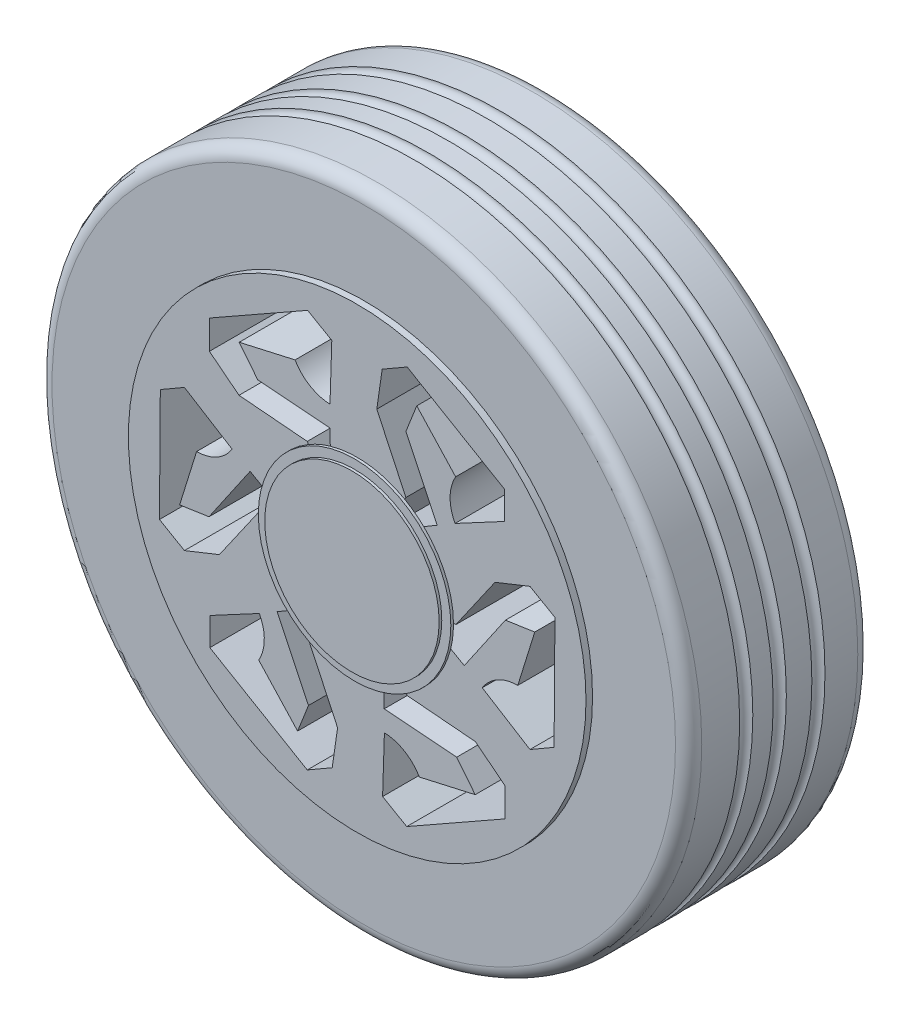
from build123d import *

# Parameters (mm, degrees)
SKETCH2_R            = 247.55
BOSS_EXTRUDE1_DEPTH  = 138.9
FILLET1_R            = 10
FILLET2_R            = 10
SKETCH3_R            = 174.35
BOSS_EXTRUDE2_DEPTH  = 5
CUT_EXTRUDE1_DEPTH   = 178
SKETCH9_R            = 73.351235991
BOSS_EXTRUDE3_DEPTH  = 2
SKETCH10_R           = 66.449367693
BOSS_EXTRUDE4_DEPTH  = 2
CUT_SWEEP1_PROFILE_R = 5
CUT_SWEEP2_PROFILE_R = 5
CUT_SWEEP3_PROFILE_R = 5


with BuildPart() as part:
    # Sketch2 → Boss-Extrude1 (new body)
    with BuildSketch(Plane.XY):
        Circle(SKETCH2_R)
    extrude(amount=BOSS_EXTRUDE1_DEPTH)

    # Fillet1
    fillet1_edges = [part.edges().sort_by_distance(p)[0] for p in [
        (-247.55, 0, 138.9),
    ]]
    fillet(fillet1_edges, radius=FILLET1_R)

    # Fillet2
    fillet2_edges = [part.edges().sort_by_distance(p)[0] for p in [
        (-247.55, 0, 0),
    ]]
    fillet(fillet2_edges, radius=FILLET2_R)

    # Sketch3 → Boss-Extrude2 (add)
    with BuildSketch(Plane.XY.offset(138.9)):
        Circle(SKETCH3_R)
    extrude(amount=BOSS_EXTRUDE2_DEPTH)

    # Sketch5 → Cut-Extrude1 (cut)
    with BuildSketch(Plane.XY.offset(143.9)):
        with BuildLine():
            Line((105.003706731, 43.369407929), (131.633696581, 54.021395774))
            Line((131.633696581, 54.021395774), (150.665269372, 43.031925067))
            Line((150.665269372, 43.031925067), (150.344554361, -0.360940867))
            Line((150.344554361, -0.360940867), (150.02910614, -43.041207894))
            Line((150.02910614, -43.041207894), (131.640430833, -53.657914533))
            Line((131.640430833, -53.657914533), (95.29019948, -31.084252667))
            ThreePointArc((95.29019948, -31.084252667), (106.873400183, -20.029907867), (122.363240346, -15.976029572))
            Line((122.363240346, -15.976029572), (135.299603851, 25.697677813))
            Line((135.299603851, 25.697677813), (112.925565246, 22.34468352))
            Line((112.925565246, 22.34468352), (81.592210025, -23.310129617))
            Line((81.592210025, -23.310129617), (40.25767623, 0.148769441))
            Line((40.25767623, 0.148769441), (75.177682959, 0.55093352))
            Line((75.177682959, 0.55093352), (105.003706731, 43.369407929))
        make_face()
        with BuildLine():
            Line((90.060862379, -69.251173556), (112.600749379, -86.987427346))
            Line((112.600749379, -86.987427346), (112.599374968, -108.963988211))
            Line((112.599374968, -108.963988211), (74.859693221, -130.38267383))
            Line((74.859693221, -130.38267383), (37.739773625, -151.449621172))
            Line((37.739773625, -151.449621172), (19.351098317, -140.832914533))
            Line((19.351098317, -140.832914533), (20.725347273, -98.065859815))
            ThreePointArc((20.725347273, -98.065859815), (36.090291044, -102.570033481), (47.345972712, -113.957689415))
            Line((47.345972712, -113.957689415), (89.90464373, -104.32405515))
            Line((89.90464373, -104.32405515), (75.813846191, -86.62406648))
            Line((75.813846191, -86.62406648), (20.608940598, -82.315991441))
            Line((20.608940598, -82.315991441), (20.25767623, -34.789785592))
            Line((20.25767623, -34.789785592), (38.065963903, -64.83031648))
            Line((38.065963903, -64.83031648), (90.060862379, -69.251173556))
        make_face()
        with BuildLine():
            Line((19.032947202, 141.008823121), (38.065894405, 151.995913278))
            Line((38.065894405, 151.995913278), (75.48486114, 130.021732964))
            Line((75.48486114, 130.021732964), (112.289332516, 108.408413278))
            Line((112.289332516, 108.408413278), (112.289332516, 87.175))
            Line((112.289332516, 87.175), (74.564852207, 66.981607148))
            ThreePointArc((74.564852207, 66.981607148), (70.78310914, 82.540125614), (75.017267633, 97.981659843))
            Line((75.017267633, 97.981659843), (45.394960121, 130.021732964))
            Line((45.394960121, 130.021732964), (37.111719056, 108.96875))
            Line((37.111719056, 108.96875), (60.983269426, 59.005861824))
            Line((60.983269426, 59.005861824), (20, 34.938555033))
            Line((20, 34.938555033), (37.111719056, 65.38125))
            Line((37.111719056, 65.38125), (14.942844352, 112.620581485))
            Line((14.942844352, 112.620581485), (19.032947202, 141.008823121))
        make_face()
        with BuildLine():
            Line((-14.942844352, -112.620581485), (-19.032947202, -141.008823121))
            Line((-19.032947202, -141.008823121), (-38.065894405, -151.995913278))
            Line((-38.065894405, -151.995913278), (-75.48486114, -130.021732964))
            Line((-75.48486114, -130.021732964), (-112.289332516, -108.408413278))
            Line((-112.289332516, -108.408413278), (-112.289332516, -87.175))
            Line((-112.289332516, -87.175), (-74.564852207, -66.981607148))
            ThreePointArc((-74.564852207, -66.981607148), (-70.78310914, -82.540125614), (-75.017267633, -97.981659843))
            Line((-75.017267633, -97.981659843), (-45.394960121, -130.021732964))
            Line((-45.394960121, -130.021732964), (-37.111719056, -108.96875))
            Line((-37.111719056, -108.96875), (-60.983269426, -59.005861824))
            Line((-60.983269426, -59.005861824), (-20, -34.938555033))
            Line((-20, -34.938555033), (-37.111719056, -65.38125))
            Line((-37.111719056, -65.38125), (-14.942844352, -112.620581485))
        make_face()
        with BuildLine():
            Line((-105.003706731, -43.369407929), (-131.633696581, -54.021395774))
            Line((-131.633696581, -54.021395774), (-150.665269372, -43.031925067))
            Line((-150.665269372, -43.031925067), (-150.344554361, 0.360940867))
            Line((-150.344554361, 0.360940867), (-150.02910614, 43.041207894))
            Line((-150.02910614, 43.041207894), (-131.640430833, 53.657914533))
            Line((-131.640430833, 53.657914533), (-95.29019948, 31.084252667))
            ThreePointArc((-95.29019948, 31.084252667), (-106.873400183, 20.029907867), (-122.363240346, 15.976029572))
            Line((-122.363240346, 15.976029572), (-135.299603851, -25.697677813))
            Line((-135.299603851, -25.697677813), (-112.925565246, -22.34468352))
            Line((-112.925565246, -22.34468352), (-81.592210025, 23.310129617))
            Line((-81.592210025, 23.310129617), (-40.25767623, -0.148769441))
            Line((-40.25767623, -0.148769441), (-75.177682959, -0.55093352))
            Line((-75.177682959, -0.55093352), (-105.003706731, -43.369407929))
        make_face()
        with BuildLine():
            Line((-90.060862379, 69.251173556), (-112.600749379, 86.987427346))
            Line((-112.600749379, 86.987427346), (-112.599374968, 108.963988211))
            Line((-112.599374968, 108.963988211), (-74.859693221, 130.38267383))
            Line((-74.859693221, 130.38267383), (-37.739773625, 151.449621172))
            Line((-37.739773625, 151.449621172), (-19.351098317, 140.832914533))
            Line((-19.351098317, 140.832914533), (-20.725347273, 98.065859815))
            ThreePointArc((-20.725347273, 98.065859815), (-36.090291044, 102.570033481), (-47.345972712, 113.957689415))
            Line((-47.345972712, 113.957689415), (-89.90464373, 104.32405515))
            Line((-89.90464373, 104.32405515), (-75.813846191, 86.62406648))
            Line((-75.813846191, 86.62406648), (-20.608940598, 82.315991441))
            Line((-20.608940598, 82.315991441), (-20.25767623, 34.789785592))
            Line((-20.25767623, 34.789785592), (-38.065963903, 64.83031648))
            Line((-38.065963903, 64.83031648), (-90.060862379, 69.251173556))
        make_face()
    extrude(amount=-CUT_EXTRUDE1_DEPTH, mode=Mode.SUBTRACT)

    # Sketch9 → Boss-Extrude3 (add)
    with BuildSketch(Plane.XY.offset(143.9)):
        Circle(SKETCH9_R)
    extrude(amount=BOSS_EXTRUDE3_DEPTH)

    # Sketch10 → Boss-Extrude4 (add)
    with BuildSketch(Plane.XY.offset(145.9)):
        Circle(SKETCH10_R)
    extrude(amount=BOSS_EXTRUDE4_DEPTH)

    # Cut-Sweep1: sweep along a path in Sketch16
    with BuildLine(Plane.XY.offset(40)) as cut_sweep1_path:
        CenterArc((0, 0), 247.55, 0, 360)
    # Cut-Sweep1 profile (on start of the path) → Cut-Sweep1 (sweep, cut)
    with BuildSketch(Plane(origin=(247.55, 0, 40), x_dir=(0, 0, 1), z_dir=(0, 1, 0))):
        Circle(CUT_SWEEP1_PROFILE_R)
    sweep(path=cut_sweep1_path.line, mode=Mode.SUBTRACT)

    # Cut-Sweep2: sweep along a path in Sketch15
    with BuildLine(Plane.XY.offset(69.45)) as cut_sweep2_path:
        CenterArc((0, 0), 247.55, 0, 360)
    # Cut-Sweep2 profile (on start of the path) → Cut-Sweep2 (sweep, cut)
    with BuildSketch(Plane(origin=(247.55, 0, 69.45), x_dir=(0, 0, 1), z_dir=(0, 1, 0))):
        Circle(CUT_SWEEP2_PROFILE_R)
    sweep(path=cut_sweep2_path.line, mode=Mode.SUBTRACT)

    # Cut-Sweep3: sweep along a path in Sketch14
    with BuildLine(Plane.XY.offset(95)) as cut_sweep3_path:
        CenterArc((0, 0), 247.55, 0, 360)
    # Cut-Sweep3 profile (on start of the path) → Cut-Sweep3 (sweep, cut)
    with BuildSketch(Plane(origin=(247.55, 0, 95), x_dir=(0, 0, 1), z_dir=(0, 1, 0))):
        Circle(CUT_SWEEP3_PROFILE_R)
    sweep(path=cut_sweep3_path.line, mode=Mode.SUBTRACT)


solid = part.part
